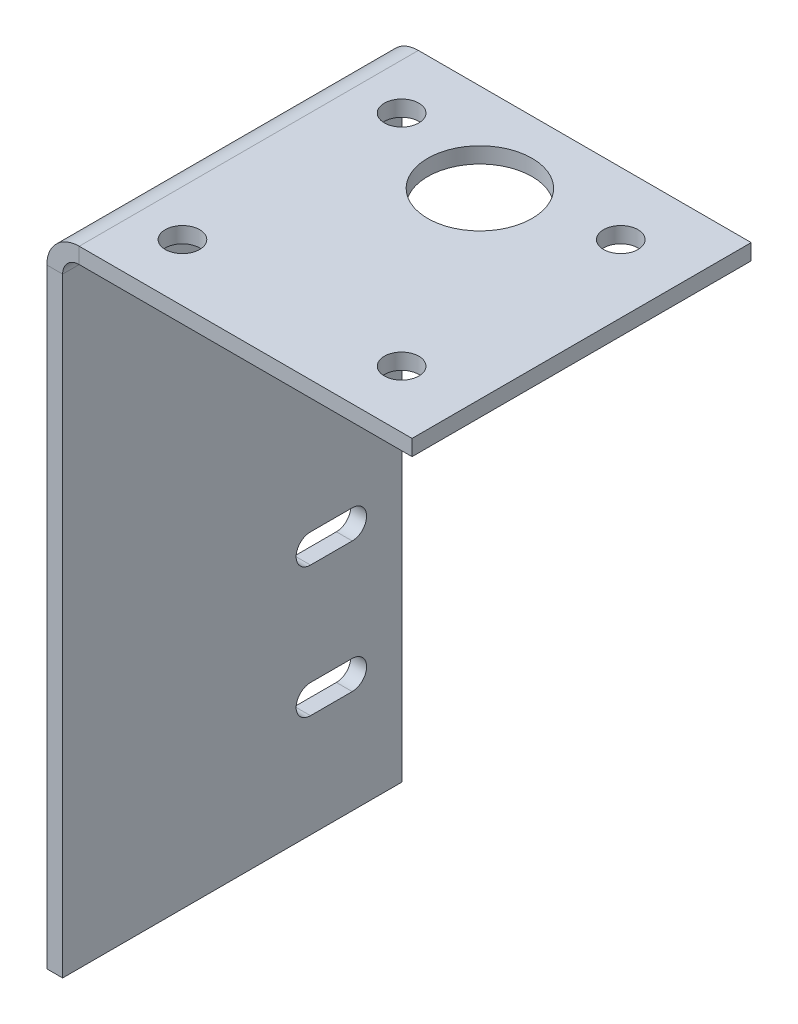
from build123d import *

# Parameters (mm, degrees)
SKETCH1_W                    = 70
SKETCH1_H                    = 65
BASE_FLANGE1_DEPTH           = 3.03784
EDGE_FLANGE1_STRIP_W         = 18.50136
EDGE_FLANGE1_STRIP_H         = 3.03784
EDGE_FLANGE1_STRIP_CUT_DEPTH = 65
EDGE_FLANGE1_DEPTH           = 65
CUT_EXTRUDE1_DEPTH           = 146.239664251
M6_CLEARANCE_HOLE1_D         = 6.6
SKETCH12_R                   = 10
CUT_EXTRUDE2_DEPTH           = 3.03784


# Sheet-metal steps are written as plain solids
with BuildPart() as part:
    # Sketch1 → Base-Flange1 (new body)
    with BuildSketch(Plane(origin=(0, 0, 0), x_dir=(1, 0, 0), z_dir=(0, 1, 0))):
        with Locations((35, 0)):
            Rectangle(SKETCH1_W, SKETCH1_H)
    extrude(amount=-BASE_FLANGE1_DEPTH)

    # Edge-Flange1 strip (across the edge) → Edge-Flange1 strip cut (cut)
    with BuildSketch(Plane(origin=(0, -3.03784, 32.5), x_dir=(1, 0, 0), z_dir=(0, 0, -1))):
        with Locations((-3.03784, -1.51892)):
            Rectangle(EDGE_FLANGE1_STRIP_W, EDGE_FLANGE1_STRIP_H)
    extrude(amount=EDGE_FLANGE1_STRIP_CUT_DEPTH, mode=Mode.SUBTRACT)

    # Edge-Flange1 section (across the edge) → Edge-Flange1 (add)
    with BuildSketch(Plane(origin=(0, -3.03784, 32.5), x_dir=(1, 0, 0), z_dir=(0, 0, -1))):
        with BuildLine():
            Line((0, 3.175), (0, 120))
            Line((0, 120), (3.03784, 120))
            Line((3.03784, 120), (3.03784, 3.175))
            ThreePointArc((3.03784, 3.175), (3.96777597, 0.92993597), (6.21284, 0))
            Line((6.21284, 0), (6.21284, -3.03784))
            ThreePointArc((6.21284, -3.03784), (1.819698706, -1.218141294), (0, 3.175))
        make_face()
    extrude(amount=EDGE_FLANGE1_DEPTH)

    # Sketch9 → Cut-Extrude1 (cut, through all)
    with BuildSketch(Plane.ZY):
        with BuildLine():
            Line((-23, -72.75), (-15, -72.75))
            ThreePointArc((-15, -72.75), (-12.25, -75.5), (-15, -78.25))
            Line((-15, -78.25), (-23, -78.25))
            ThreePointArc((-23, -78.25), (-25.75, -75.5), (-23, -72.75))
        make_face()
        with BuildLine():
            Line((-23, -97.75), (-15, -97.75))
            ThreePointArc((-15, -97.75), (-12.25, -100.5), (-15, -103.25))
            Line((-15, -103.25), (-23, -103.25))
            ThreePointArc((-23, -103.25), (-25.75, -100.5), (-23, -97.75))
        make_face()
    extrude(amount=-CUT_EXTRUDE1_DEPTH, mode=Mode.SUBTRACT)

    # M6 Clearance Hole1 (through all)
    with Locations(Plane(origin=(0, 0, 0), x_dir=(1, 0, 0), z_dir=(0, 1, 0))):
        with Locations((57, 20.5), (57, -21.5), (15, -21.5), (15, 20.5)):
            Hole(M6_CLEARANCE_HOLE1_D / 2)

    # Sketch12 → Cut-Extrude2 (cut)
    with BuildSketch(Plane.XZ.offset(3.03784)):
        with Locations(Location((35, -15.5, 0), (0, 0, 270))):
            Circle(SKETCH12_R)
    extrude(amount=-CUT_EXTRUDE2_DEPTH, mode=Mode.SUBTRACT)


solid = part.part
